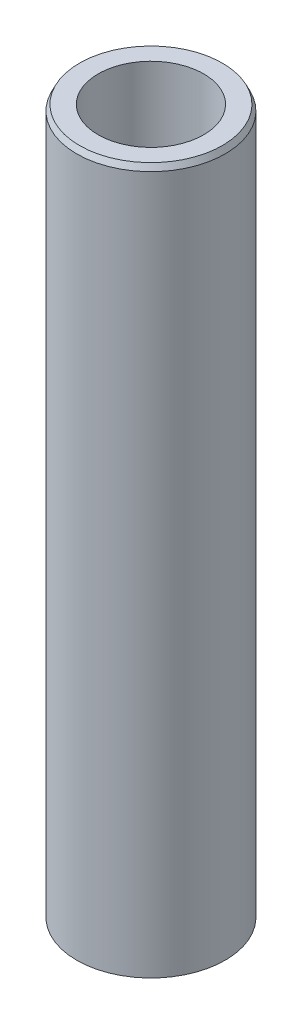
from build123d import *
from OCP.BRepFilletAPI import BRepFilletAPI_MakeChamfer

# Parameters (mm, degrees)
SKETCH1_R           = 50
BOSS_EXTRUDE1_DEPTH = 476.060575571
SKETCH2_R           = 35.549599995
CUT_EXTRUDE1_DEPTH  = 482.283358961
CHAMFER1_SIZE       = 3.925114364
CHAMFER1_SIZE2      = 1.897450607


with BuildPart() as part:
    # Sketch1 → Boss-Extrude1 (new body)
    with BuildSketch(Plane(origin=(0, 0, 0), x_dir=(1, 0, 0), z_dir=(0, 1, 0))):
        Circle(SKETCH1_R)
    extrude(amount=BOSS_EXTRUDE1_DEPTH)

    # Sketch2 → Cut-Extrude1 (cut, through all)
    with BuildSketch(Plane(origin=(0, 0, 0), x_dir=(1, 0, 0), z_dir=(0, 1, 0))):
        Circle(SKETCH2_R)
    extrude(amount=CUT_EXTRUDE1_DEPTH, mode=Mode.SUBTRACT)

    # Chamfer1: one chamfer whose edges measure the first distance from different faces: ONE call of the kernel's chamfer builder (chamfer() names one face for all edges)
    chamfer1_edges_1 = [part.edges().sort_by_distance(p)[0] for p in [
        (-50, 476.060575571, 0),
    ]]
    chamfer1_side_1 = [part.faces().sort_by_distance(p)[0] for p in [
        (-50, 238.030287785, 0),
    ]]
    chamfer1_edges_2 = [part.edges().sort_by_distance(p)[0] for p in [
        (-50, 0, 0),
    ]]
    chamfer1_side_2 = [part.faces().sort_by_distance(p)[0] for p in [
        (-48.585786438, 0, 0),
    ]]
    chamfer1 = BRepFilletAPI_MakeChamfer(part.part.solid().wrapped)
    for e in chamfer1_edges_1:
        chamfer1.Add(CHAMFER1_SIZE, CHAMFER1_SIZE2, e.wrapped, chamfer1_side_1[0].wrapped)  # the first distance lies on this face
    for e in chamfer1_edges_2:
        chamfer1.Add(CHAMFER1_SIZE, CHAMFER1_SIZE2, e.wrapped, chamfer1_side_2[0].wrapped)  # the first distance lies on this face
    add(Compound.cast(chamfer1.Shape()), mode=Mode.REPLACE)


solid = part.part
